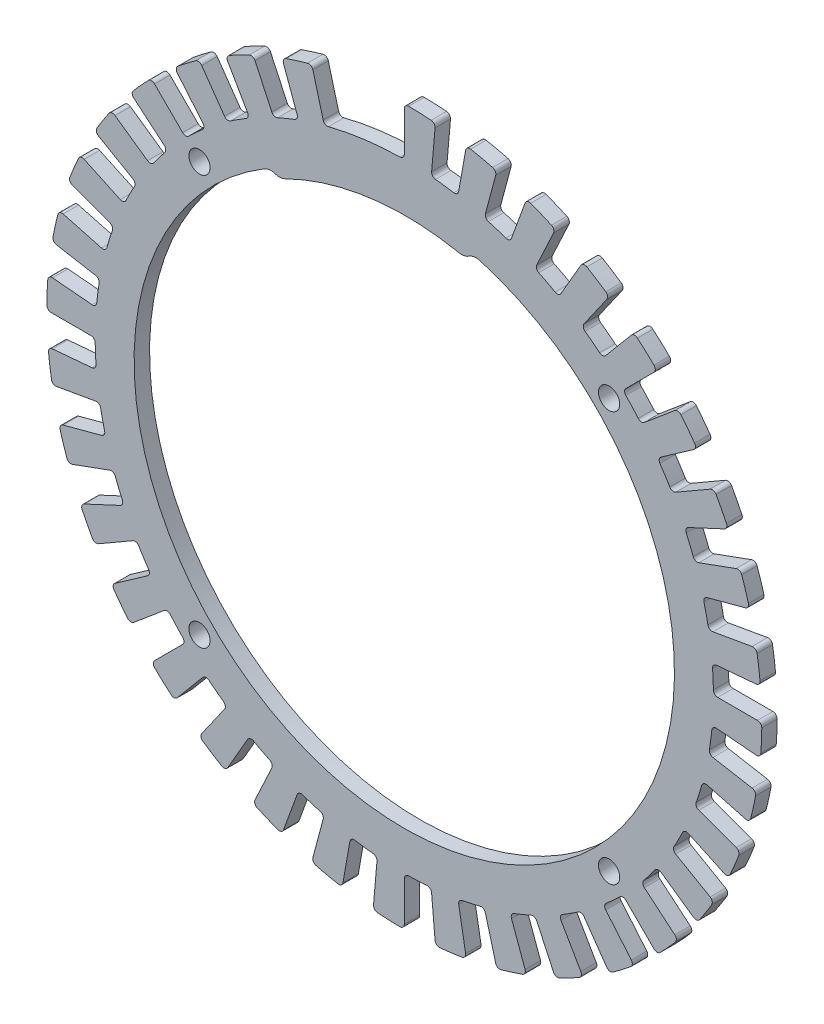
from build123d import *

# Parameters (mm, degrees)
SKETCH1_R           = 2.4585
BOSS_EXTRUDE1_DEPTH = 3.571875


with BuildPart() as part:
    # Sketch1 → Boss-Extrude1 (new body)
    with BuildSketch(Plane.XY):
        with BuildLine():
            Line((7.120090774, 81.383009943), (6.318190247, 72.217244977))
            ThreePointArc((6.318190247, 72.217244977), (6.543925597, 71.492600102), (7.213496876, 71.135191451))
            ThreePointArc((7.213496876, 71.135191451), (9.332622744, 70.888307588), (11.443439394, 70.578308954))
            ThreePointArc((11.443439394, 70.578308954), (12.182699751, 70.750241401), (12.58829525, 71.391769993))
            Line((12.58829525, 71.391769993), (14.185993357, 80.45276622))
            ThreePointArc((14.185993357, 80.45276622), (14.60224868, 81.101765071), (15.35649023, 81.261726586))
            ThreePointArc((15.35649023, 81.261726586), (17.899556073, 80.739679789), (20.424982959, 80.138068801))
            ThreePointArc((20.424982959, 80.138068801), (21.040955292, 79.674338181), (21.143931966, 78.910228368))
            Line((21.143931966, 78.910228368), (18.762595726, 70.022960532))
            ThreePointArc((18.762595726, 70.022960532), (18.859068387, 69.270126109), (19.456404014, 68.801877466))
            ThreePointArc((19.456404014, 68.801877466), (21.500464665, 68.190761978), (23.525382569, 67.518933456))
            ThreePointArc((23.525382569, 67.518933456), (24.283267656, 67.559882649), (24.794101519, 68.12123406))
            Line((24.794101519, 68.12123406), (27.940952485, 76.76713603))
            ThreePointArc((27.940952485, 76.76713603), (28.463581422, 77.333993152), (29.234141374, 77.360551822))
            ThreePointArc((29.234141374, 77.360551822), (31.647919857, 76.404837339), (34.030511182, 75.373830397))
            ThreePointArc((34.030511182, 75.373830397), (34.556599534, 74.810182414), (34.525325484, 74.039799434))
            Line((34.525325484, 74.039799434), (30.636909229, 65.701063864))
            ThreePointArc((30.636909229, 65.701063864), (30.601187928, 64.942914386), (31.108138161, 64.378053249))
            ThreePointArc((31.108138161, 64.378053249), (33.015025846, 63.421274572), (34.892518899, 62.40802933))
            ThreePointArc((34.892518899, 62.40802933), (35.646000762, 62.316751049), (36.24655156, 62.780868901))
            Line((36.24655156, 62.780868901), (40.84693991, 70.748975258))
            ThreePointArc((40.84693991, 70.748975258), (41.460062645, 71.216466984), (42.223527925, 71.108815836))
            ThreePointArc((42.223527925, 71.108815836), (44.43467761, 69.748472569), (46.602039543, 68.319396297))
            ThreePointArc((46.602039543, 68.319396297), (47.022258986, 67.67295711), (46.857684459, 66.91970866))
            Line((46.857684459, 66.91970866), (41.580335748, 59.382873618))
            ThreePointArc((41.580335748, 59.382873618), (41.413505858, 58.642445073), (41.814667271, 57.998134462))
            ThreePointArc((41.814667271, 57.998134462), (43.526442174, 56.724763831), (45.199463699, 55.400888814))
            ThreePointArc((45.199463699, 55.400888814), (45.925648172, 55.180156502), (46.597668473, 55.53293881))
            Line((46.597668473, 55.53293881), (52.511813735, 62.581142673))
            ThreePointArc((52.511813735, 62.581142673), (53.196800845, 62.935064503), (53.929973946, 62.696474464))
            ThreePointArc((53.929973946, 62.696474464), (55.87131017, 60.972835754), (57.757588515, 59.189111912))
            ThreePointArc((57.757588515, 59.189111912), (58.059170893, 58.479523249), (57.766296402, 57.766296402))
            Line((57.766296402, 57.766296402), (51.260364806, 51.260364806))
            ThreePointArc((51.260364806, 51.260364806), (50.967495369, 50.56015474), (51.250678875, 49.855971707))
            ThreePointArc((51.250678875, 49.855971707), (52.715329582, 48.304699845), (54.133045666, 46.710420325))
            ThreePointArc((54.133045666, 46.710420325), (54.809868002, 46.366940822), (55.53293881, 46.597668473))
            Line((55.53293881, 46.597668473), (62.581142673, 52.511813735))
            ThreePointArc((62.581142673, 52.511813735), (63.31718117, 52.741411935), (63.997784998, 52.379132441))
            ThreePointArc((63.997784998, 52.379132441), (65.610321242, 50.344570179), (67.158202386, 48.260396313))
            ThreePointArc((67.158202386, 48.260396313), (67.331984272, 47.509218665), (66.91970866, 46.857684459))
            Line((66.91970866, 46.857684459), (59.382873618, 41.580335748))
            ThreePointArc((59.382873618, 41.580335748), (58.972863325, 40.94161969), (59.129464536, 40.19896048))
            ThreePointArc((59.129464536, 40.19896048), (60.302488376, 38.416921997), (61.421822434, 36.600679351))
            ThreePointArc((61.421822434, 36.600679351), (62.028717727, 36.144889108), (62.780868901, 36.24655156))
            Line((62.780868901, 36.24655156), (70.748975258, 40.84693991))
            ThreePointArc((70.748975258, 40.84693991), (71.513700985, 40.945238253), (72.121055738, 40.470276985))
            ThreePointArc((72.121055738, 40.470276985), (73.355795904, 38.186610315), (74.518248261, 35.865312993))
            ThreePointArc((74.518248261, 35.865312993), (74.55894938, 35.095370514), (74.039799434, 34.525325484))
            Line((74.039799434, 34.525325484), (65.701063864, 30.636909229))
            ThreePointArc((65.701063864, 30.636909229), (65.186370669, 30.079094244), (65.211631338, 29.320524181))
            ThreePointArc((65.211631338, 29.320524181), (66.057386575, 27.361865414), (66.844328207, 25.378845255))
            ThreePointArc((66.844328207, 25.378845255), (67.362856253, 24.824593229), (68.12123406, 24.794101519))
            Line((68.12123406, 24.794101519), (76.76713603, 27.940952485))
            ThreePointArc((76.76713603, 27.940952485), (77.537313183, 27.904964226), (78.052964694, 27.331752641))
            ThreePointArc((78.052964694, 27.331752641), (78.872391827, 24.868369619), (79.614094871, 22.380480286))
            ThreePointArc((79.614094871, 22.380480286), (79.52047854, 21.615167288), (78.910228368, 21.143931966))
            Line((78.910228368, 21.143931966), (70.022960532, 18.762595726))
            ThreePointArc((70.022960532, 18.762595726), (69.419223127, 18.30263074), (69.312375721, 17.551198591))
            ThreePointArc((69.312375721, 17.551198591), (69.805164509, 15.475432397), (70.235802893, 13.385887789))
            ThreePointArc((70.235802893, 13.385887789), (70.650208479, 12.750014647), (71.391769993, 12.58829525))
            Line((71.391769993, 12.58829525), (80.45276622, 14.185993357))
            ThreePointArc((80.45276622, 14.185993357), (81.204993357, 14.016811982), (81.613273815, 13.362766823))
            ThreePointArc((81.613273815, 13.362766823), (81.992490036, 10.794516097), (82.290907495, 8.215628011))
            ThreePointArc((82.290907495, 8.215628011), (82.065818199, 7.478198142), (81.383009943, 7.120090774))
            Line((81.383009943, 7.120090774), (72.217244977, 6.318190247))
            ThreePointArc((72.217244977, 6.318190247), (71.542807618, 5.970051062), (71.30709864, 5.248588713))
            ThreePointArc((71.30709864, 5.248588713), (71.431947843, 3.118786197), (71.49319825, 0.986206897))
            ThreePointArc((71.49319825, 0.986206897), (71.79088987, 0.288033321), (72.49310312, 0))
            Line((72.49310312, 0), (81.69387982, 0))
            ThreePointArc((81.69387982, 0), (82.405300898, -0.297234001), (82.693804909, -1.012239902))
            ThreePointArc((82.693804909, -1.012239902), (82.621287925, -3.607323335), (82.467352536, -6.198851964))
            ThreePointArc((82.467352536, -6.198851964), (82.1176295, -6.88599227), (81.383009943, -7.120090774))
            Line((81.383009943, -7.120090774), (72.217244977, -6.318190247))
            ThreePointArc((72.217244977, -6.318190247), (71.492600102, -6.543925597), (71.135191451, -7.213496876))
            ThreePointArc((71.135191451, -7.213496876), (70.888307588, -9.332622744), (70.578308954, -11.443439394))
            ThreePointArc((70.578308954, -11.443439394), (70.750241401, -12.182699751), (71.391769993, -12.58829525))
            Line((71.391769993, -12.58829525), (80.45276622, -14.185993357))
            ThreePointArc((80.45276622, -14.185993357), (81.101765071, -14.60224868), (81.261726586, -15.35649023))
            ThreePointArc((81.261726586, -15.35649023), (80.739679789, -17.899556073), (80.138068801, -20.424982959))
            ThreePointArc((80.138068801, -20.424982959), (79.674338181, -21.040955292), (78.910228368, -21.143931966))
            Line((78.910228368, -21.143931966), (70.022960532, -18.762595726))
            ThreePointArc((70.022960532, -18.762595726), (69.270126109, -18.859068387), (68.801877466, -19.456404014))
            ThreePointArc((68.801877466, -19.456404014), (68.190761979, -21.500464665), (67.518933456, -23.525382569))
            ThreePointArc((67.518933456, -23.525382569), (67.559882649, -24.283267656), (68.12123406, -24.794101519))
            Line((68.12123406, -24.794101519), (76.76713603, -27.940952485))
            ThreePointArc((76.76713603, -27.940952485), (77.333993152, -28.463581422), (77.360551822, -29.234141374))
            ThreePointArc((77.360551822, -29.234141374), (76.404837339, -31.647919857), (75.373830397, -34.030511182))
            ThreePointArc((75.373830397, -34.030511182), (74.810182414, -34.556599534), (74.039799434, -34.525325484))
            Line((74.039799434, -34.525325484), (65.701063864, -30.636909229))
            ThreePointArc((65.701063864, -30.636909229), (64.942914386, -30.601187928), (64.378053249, -31.10813816))
            ThreePointArc((64.378053249, -31.10813816), (63.421274572, -33.015025846), (62.40802933, -34.892518899))
            ThreePointArc((62.40802933, -34.892518899), (62.316751049, -35.646000762), (62.780868901, -36.24655156))
            Line((62.780868901, -36.24655156), (70.748975258, -40.84693991))
            ThreePointArc((70.748975258, -40.84693991), (71.216466984, -41.460062645), (71.108815836, -42.223527925))
            ThreePointArc((71.108815836, -42.223527925), (69.748472569, -44.43467761), (68.319396297, -46.602039543))
            ThreePointArc((68.319396297, -46.602039543), (67.67295711, -47.022258986), (66.91970866, -46.857684459))
            Line((66.91970866, -46.857684459), (59.382873618, -41.580335748))
            ThreePointArc((59.382873618, -41.580335748), (58.642445073, -41.413505858), (57.998134462, -41.814667271))
            ThreePointArc((57.998134462, -41.814667271), (56.724763831, -43.526442174), (55.400888814, -45.199463699))
            ThreePointArc((55.400888814, -45.199463699), (55.180156502, -45.925648172), (55.53293881, -46.597668473))
            Line((55.53293881, -46.597668473), (62.581142673, -52.511813735))
            ThreePointArc((62.581142673, -52.511813735), (62.935064503, -53.196800845), (62.696474464, -53.929973946))
            ThreePointArc((62.696474464, -53.929973946), (60.972835754, -55.87131017), (59.189111912, -57.757588515))
            ThreePointArc((59.189111912, -57.757588515), (58.479523249, -58.059170893), (57.766296402, -57.766296402))
            Line((57.766296402, -57.766296402), (51.260364806, -51.260364806))
            ThreePointArc((51.260364806, -51.260364806), (50.56015474, -50.967495369), (49.855971707, -51.250678875))
            ThreePointArc((49.855971707, -51.250678875), (48.304699845, -52.715329582), (46.710420325, -54.133045666))
            ThreePointArc((46.710420325, -54.133045666), (46.366940822, -54.809868002), (46.597668473, -55.53293881))
            Line((46.597668473, -55.53293881), (52.511813735, -62.581142673))
            ThreePointArc((52.511813735, -62.581142673), (52.741411935, -63.31718117), (52.379132441, -63.997784998))
            ThreePointArc((52.379132441, -63.997784998), (50.344570179, -65.610321242), (48.260396313, -67.158202386))
            ThreePointArc((48.260396313, -67.158202386), (47.509218665, -67.331984272), (46.857684459, -66.91970866))
            Line((46.857684459, -66.91970866), (41.580335748, -59.382873618))
            ThreePointArc((41.580335748, -59.382873618), (40.94161969, -58.972863325), (40.19896048, -59.129464536))
            ThreePointArc((40.19896048, -59.129464536), (38.416921997, -60.302488376), (36.600679351, -61.421822434))
            ThreePointArc((36.600679351, -61.421822434), (36.144889108, -62.028717727), (36.24655156, -62.780868901))
            Line((36.24655156, -62.780868901), (40.84693991, -70.748975258))
            ThreePointArc((40.84693991, -70.748975258), (40.945238253, -71.513700985), (40.470276985, -72.121055738))
            ThreePointArc((40.470276985, -72.121055738), (38.186610315, -73.355795904), (35.865312993, -74.518248261))
            ThreePointArc((35.865312993, -74.518248261), (35.095370514, -74.55894938), (34.525325484, -74.039799434))
            Line((34.525325484, -74.039799434), (30.636909229, -65.701063864))
            ThreePointArc((30.636909229, -65.701063864), (30.079094244, -65.186370669), (29.320524181, -65.211631338))
            ThreePointArc((29.320524181, -65.211631338), (27.361865414, -66.057386575), (25.378845255, -66.844328207))
            ThreePointArc((25.378845255, -66.844328207), (24.824593229, -67.362856253), (24.794101519, -68.12123406))
            Line((24.794101519, -68.12123406), (27.940952485, -76.76713603))
            ThreePointArc((27.940952485, -76.76713603), (27.904964226, -77.537313183), (27.331752641, -78.052964694))
            ThreePointArc((27.331752641, -78.052964694), (24.868369619, -78.872391827), (22.380480286, -79.614094871))
            ThreePointArc((22.380480286, -79.614094871), (21.615167288, -79.52047854), (21.143931966, -78.910228368))
            Line((21.143931966, -78.910228368), (18.762595726, -70.022960532))
            ThreePointArc((18.762595726, -70.022960532), (18.30263074, -69.419223127), (17.551198591, -69.312375721))
            ThreePointArc((17.551198591, -69.312375721), (15.475432397, -69.805164509), (13.385887789, -70.235802893))
            ThreePointArc((13.385887789, -70.235802893), (12.750014647, -70.650208479), (12.58829525, -71.391769993))
            Line((12.58829525, -71.391769993), (14.185993357, -80.45276622))
            ThreePointArc((14.185993357, -80.45276622), (14.016811982, -81.204993357), (13.362766823, -81.613273815))
            ThreePointArc((13.362766823, -81.613273815), (10.794516097, -81.992490036), (8.215628011, -82.290907495))
            ThreePointArc((8.215628011, -82.290907495), (7.478198142, -82.065818199), (7.120090774, -81.383009943))
            Line((7.120090774, -81.383009943), (6.318190247, -72.217244977))
            ThreePointArc((6.318190247, -72.217244977), (5.970051062, -71.542807618), (5.248588713, -71.30709864))
            ThreePointArc((5.248588713, -71.30709864), (3.118786197, -71.431947843), (0.986206897, -71.49319825))
            ThreePointArc((0.986206897, -71.49319825), (0.288033321, -71.79088987), (0, -72.49310312))
            Line((0, -72.49310312), (0, -81.69387982))
            ThreePointArc((0, -81.69387982), (-0.297234001, -82.405300898), (-1.012239902, -82.693804909))
            ThreePointArc((-1.012239902, -82.693804909), (-3.607323335, -82.621287925), (-6.198851964, -82.467352536))
            ThreePointArc((-6.198851964, -82.467352536), (-6.88599227, -82.1176295), (-7.120090774, -81.383009943))
            Line((-7.120090774, -81.383009943), (-6.318190247, -72.217244977))
            ThreePointArc((-6.318190247, -72.217244977), (-6.543925597, -71.492600102), (-7.213496876, -71.135191451))
            ThreePointArc((-7.213496876, -71.135191451), (-9.332622744, -70.888307588), (-11.443439394, -70.578308954))
            ThreePointArc((-11.443439394, -70.578308954), (-12.182699751, -70.750241401), (-12.58829525, -71.391769993))
            Line((-12.58829525, -71.391769993), (-14.185993357, -80.45276622))
            ThreePointArc((-14.185993357, -80.45276622), (-14.60224868, -81.101765071), (-15.35649023, -81.261726586))
            ThreePointArc((-15.35649023, -81.261726586), (-17.899556073, -80.739679789), (-20.424982959, -80.138068801))
            ThreePointArc((-20.424982959, -80.138068801), (-21.040955292, -79.674338181), (-21.143931966, -78.910228368))
            Line((-21.143931966, -78.910228368), (-18.762595726, -70.022960532))
            ThreePointArc((-18.762595726, -70.022960532), (-18.859068387, -69.270126109), (-19.456404014, -68.801877466))
            ThreePointArc((-19.456404014, -68.801877466), (-21.500464665, -68.190761979), (-23.525382569, -67.518933456))
            ThreePointArc((-23.525382569, -67.518933456), (-24.283267656, -67.559882649), (-24.794101519, -68.12123406))
            Line((-24.794101519, -68.12123406), (-27.940952485, -76.76713603))
            ThreePointArc((-27.940952485, -76.76713603), (-28.463581422, -77.333993152), (-29.234141374, -77.360551822))
            ThreePointArc((-29.234141374, -77.360551822), (-31.647919857, -76.404837339), (-34.030511182, -75.373830397))
            ThreePointArc((-34.030511182, -75.373830397), (-34.556599534, -74.810182414), (-34.525325484, -74.039799434))
            Line((-34.525325484, -74.039799434), (-30.636909229, -65.701063864))
            ThreePointArc((-30.636909229, -65.701063864), (-30.601187928, -64.942914386), (-31.10813816, -64.378053249))
            ThreePointArc((-31.10813816, -64.378053249), (-33.015025846, -63.421274572), (-34.892518899, -62.40802933))
            ThreePointArc((-34.892518899, -62.40802933), (-35.646000762, -62.316751049), (-36.24655156, -62.780868901))
            Line((-36.24655156, -62.780868901), (-40.84693991, -70.748975258))
            ThreePointArc((-40.84693991, -70.748975258), (-41.460062645, -71.216466984), (-42.223527925, -71.108815836))
            ThreePointArc((-42.223527925, -71.108815836), (-44.43467761, -69.748472569), (-46.602039543, -68.319396297))
            ThreePointArc((-46.602039543, -68.319396297), (-47.022258986, -67.67295711), (-46.857684459, -66.91970866))
            Line((-46.857684459, -66.91970866), (-41.580335748, -59.382873618))
            ThreePointArc((-41.580335748, -59.382873618), (-41.413505858, -58.642445073), (-41.814667271, -57.998134462))
            ThreePointArc((-41.814667271, -57.998134462), (-43.526442174, -56.724763831), (-45.199463699, -55.400888814))
            ThreePointArc((-45.199463699, -55.400888814), (-45.925648172, -55.180156502), (-46.597668473, -55.53293881))
            Line((-46.597668473, -55.53293881), (-52.511813735, -62.581142673))
            ThreePointArc((-52.511813735, -62.581142673), (-53.196800845, -62.935064504), (-53.929973946, -62.696474464))
            ThreePointArc((-53.929973946, -62.696474464), (-55.87131017, -60.972835754), (-57.757588515, -59.189111912))
            ThreePointArc((-57.757588515, -59.189111912), (-58.059170893, -58.479523249), (-57.766296402, -57.766296402))
            Line((-57.766296402, -57.766296402), (-51.260364806, -51.260364806))
            ThreePointArc((-51.260364806, -51.260364806), (-50.967495369, -50.56015474), (-51.250678875, -49.855971707))
            ThreePointArc((-51.250678875, -49.855971707), (-52.715329582, -48.304699845), (-54.133045666, -46.710420325))
            ThreePointArc((-54.133045666, -46.710420325), (-54.809868002, -46.366940822), (-55.53293881, -46.597668473))
            Line((-55.53293881, -46.597668473), (-62.581142673, -52.511813735))
            ThreePointArc((-62.581142673, -52.511813735), (-63.31718117, -52.741411935), (-63.997784998, -52.379132441))
            ThreePointArc((-63.997784998, -52.379132441), (-65.610321242, -50.344570179), (-67.158202386, -48.260396313))
            ThreePointArc((-67.158202386, -48.260396313), (-67.331984272, -47.509218665), (-66.91970866, -46.857684459))
            Line((-66.91970866, -46.857684459), (-59.382873618, -41.580335748))
            ThreePointArc((-59.382873618, -41.580335748), (-58.972863325, -40.94161969), (-59.129464536, -40.19896048))
            ThreePointArc((-59.129464536, -40.19896048), (-60.302488376, -38.416921997), (-61.421822434, -36.600679351))
            ThreePointArc((-61.421822434, -36.600679351), (-62.028717727, -36.144889108), (-62.780868901, -36.24655156))
            Line((-62.780868901, -36.24655156), (-70.748975258, -40.84693991))
            ThreePointArc((-70.748975258, -40.84693991), (-71.513700985, -40.945238253), (-72.121055738, -40.470276985))
            ThreePointArc((-72.121055738, -40.470276985), (-73.355795904, -38.186610315), (-74.518248261, -35.865312993))
            ThreePointArc((-74.518248261, -35.865312993), (-74.55894938, -35.095370514), (-74.039799434, -34.525325484))
            Line((-74.039799434, -34.525325484), (-65.701063864, -30.636909229))
            ThreePointArc((-65.701063864, -30.636909229), (-65.186370669, -30.079094244), (-65.211631338, -29.320524181))
            ThreePointArc((-65.211631338, -29.320524181), (-66.057386575, -27.361865414), (-66.844328207, -25.378845255))
            ThreePointArc((-66.844328207, -25.378845255), (-67.362856253, -24.824593229), (-68.12123406, -24.794101519))
            Line((-68.12123406, -24.794101519), (-76.76713603, -27.940952485))
            ThreePointArc((-76.76713603, -27.940952485), (-77.537313183, -27.904964226), (-78.052964694, -27.331752641))
            ThreePointArc((-78.052964694, -27.331752641), (-78.872391827, -24.868369619), (-79.614094871, -22.380480286))
            ThreePointArc((-79.614094871, -22.380480286), (-79.52047854, -21.615167288), (-78.910228368, -21.143931966))
            Line((-78.910228368, -21.143931966), (-70.022960532, -18.762595726))
            ThreePointArc((-70.022960532, -18.762595726), (-69.419223127, -18.30263074), (-69.312375721, -17.551198591))
            ThreePointArc((-69.312375721, -17.551198591), (-69.805164509, -15.475432397), (-70.235802893, -13.385887789))
            ThreePointArc((-70.235802893, -13.385887789), (-70.650208479, -12.750014647), (-71.391769993, -12.58829525))
            Line((-71.391769993, -12.58829525), (-80.45276622, -14.185993357))
            ThreePointArc((-80.45276622, -14.185993357), (-81.204993357, -14.016811982), (-81.613273815, -13.362766823))
            ThreePointArc((-81.613273815, -13.362766823), (-81.992490036, -10.794516097), (-82.290907495, -8.215628011))
            ThreePointArc((-82.290907495, -8.215628011), (-82.065818199, -7.478198142), (-81.383009943, -7.120090774))
            Line((-81.383009943, -7.120090774), (-72.217244977, -6.318190247))
            ThreePointArc((-72.217244977, -6.318190247), (-71.542807618, -5.970051062), (-71.30709864, -5.248588713))
            ThreePointArc((-71.30709864, -5.248588713), (-71.431947843, -3.118786197), (-71.49319825, -0.986206897))
            ThreePointArc((-71.49319825, -0.986206897), (-71.79088987, -0.288033321), (-72.49310312, 0))
            Line((-72.49310312, 0), (-81.69387982, 0))
            ThreePointArc((-81.69387982, 0), (-82.405300898, 0.297234001), (-82.693804909, 1.012239902))
            ThreePointArc((-82.693804909, 1.012239902), (-82.621287925, 3.607323335), (-82.467352536, 6.198851964))
            ThreePointArc((-82.467352536, 6.198851964), (-82.1176295, 6.88599227), (-81.383009943, 7.120090774))
            Line((-81.383009943, 7.120090774), (-72.217244977, 6.318190247))
            ThreePointArc((-72.217244977, 6.318190247), (-71.492600102, 6.543925597), (-71.135191451, 7.213496876))
            ThreePointArc((-71.135191451, 7.213496876), (-70.888307588, 9.332622744), (-70.578308954, 11.443439394))
            ThreePointArc((-70.578308954, 11.443439394), (-70.750241401, 12.182699751), (-71.391769993, 12.58829525))
            Line((-71.391769993, 12.58829525), (-80.45276622, 14.185993357))
            ThreePointArc((-80.45276622, 14.185993357), (-81.101765071, 14.60224868), (-81.261726586, 15.35649023))
            ThreePointArc((-81.261726586, 15.35649023), (-80.739679789, 17.899556073), (-80.138068801, 20.424982959))
            ThreePointArc((-80.138068801, 20.424982959), (-79.674338181, 21.040955292), (-78.910228368, 21.143931966))
            Line((-78.910228368, 21.143931966), (-70.022960532, 18.762595726))
            ThreePointArc((-70.022960532, 18.762595726), (-69.270126109, 18.859068387), (-68.801877466, 19.456404014))
            ThreePointArc((-68.801877466, 19.456404014), (-68.190761979, 21.500464665), (-67.518933456, 23.525382569))
            ThreePointArc((-67.518933456, 23.525382569), (-67.559882649, 24.283267656), (-68.12123406, 24.794101519))
            Line((-68.12123406, 24.794101519), (-76.76713603, 27.940952485))
            ThreePointArc((-76.76713603, 27.940952485), (-77.333993152, 28.463581422), (-77.360551822, 29.234141374))
            ThreePointArc((-77.360551822, 29.234141374), (-76.404837339, 31.647919857), (-75.373830397, 34.030511182))
            ThreePointArc((-75.373830397, 34.030511182), (-74.810182414, 34.556599534), (-74.039799434, 34.525325484))
            Line((-74.039799434, 34.525325484), (-65.701063864, 30.636909229))
            ThreePointArc((-65.701063864, 30.636909229), (-64.942914386, 30.601187928), (-64.378053249, 31.10813816))
            ThreePointArc((-64.378053249, 31.10813816), (-63.421274572, 33.015025846), (-62.40802933, 34.892518899))
            ThreePointArc((-62.40802933, 34.892518899), (-62.316751049, 35.646000762), (-62.780868901, 36.24655156))
            Line((-62.780868901, 36.24655156), (-70.748975258, 40.84693991))
            ThreePointArc((-70.748975258, 40.84693991), (-71.216466984, 41.460062645), (-71.108815836, 42.223527925))
            ThreePointArc((-71.108815836, 42.223527925), (-69.748472569, 44.43467761), (-68.319396297, 46.602039543))
            ThreePointArc((-68.319396297, 46.602039543), (-67.67295711, 47.022258986), (-66.91970866, 46.857684459))
            Line((-66.91970866, 46.857684459), (-59.382873618, 41.580335748))
            ThreePointArc((-59.382873618, 41.580335748), (-58.642445073, 41.413505858), (-57.998134462, 41.814667271))
            ThreePointArc((-57.998134462, 41.814667271), (-56.724763831, 43.526442174), (-55.400888814, 45.199463699))
            ThreePointArc((-55.400888814, 45.199463699), (-55.180156502, 45.925648172), (-55.53293881, 46.597668473))
            Line((-55.53293881, 46.597668473), (-62.581142673, 52.511813735))
            ThreePointArc((-62.581142673, 52.511813735), (-62.935064504, 53.196800845), (-62.696474464, 53.929973946))
            ThreePointArc((-62.696474464, 53.929973946), (-60.972835754, 55.87131017), (-59.189111912, 57.757588515))
            ThreePointArc((-59.189111912, 57.757588515), (-58.479523249, 58.059170893), (-57.766296402, 57.766296402))
            Line((-57.766296402, 57.766296402), (-51.260364806, 51.260364806))
            ThreePointArc((-51.260364806, 51.260364806), (-50.56015474, 50.967495369), (-49.855971707, 51.250678875))
            ThreePointArc((-49.855971707, 51.250678875), (-48.304699845, 52.715329582), (-46.710420325, 54.133045666))
            ThreePointArc((-46.710420325, 54.133045666), (-46.366940822, 54.809868002), (-46.597668473, 55.53293881))
            Line((-46.597668473, 55.53293881), (-52.511813735, 62.581142673))
            ThreePointArc((-52.511813735, 62.581142673), (-52.741411935, 63.31718117), (-52.379132441, 63.997784998))
            ThreePointArc((-52.379132441, 63.997784998), (-50.344570179, 65.610321242), (-48.260396313, 67.158202386))
            ThreePointArc((-48.260396313, 67.158202386), (-47.509218665, 67.331984272), (-46.857684459, 66.91970866))
            Line((-46.857684459, 66.91970866), (-41.580335748, 59.382873618))
            ThreePointArc((-41.580335748, 59.382873618), (-40.94161969, 58.972863325), (-40.19896048, 59.129464536))
            ThreePointArc((-40.19896048, 59.129464536), (-38.416921997, 60.302488376), (-36.600679351, 61.421822434))
            ThreePointArc((-36.600679351, 61.421822434), (-36.144889108, 62.028717727), (-36.24655156, 62.780868901))
            Line((-36.24655156, 62.780868901), (-40.84693991, 70.748975258))
            ThreePointArc((-40.84693991, 70.748975258), (-40.945238253, 71.513700985), (-40.470276985, 72.121055738))
            ThreePointArc((-40.470276985, 72.121055738), (-38.186610315, 73.355795904), (-35.865312993, 74.518248261))
            ThreePointArc((-35.865312993, 74.518248261), (-35.095370514, 74.55894938), (-34.525325484, 74.039799434))
            Line((-34.525325484, 74.039799434), (-30.636909229, 65.701063864))
            ThreePointArc((-30.636909229, 65.701063864), (-30.079094244, 65.186370669), (-29.320524181, 65.211631338))
            ThreePointArc((-29.320524181, 65.211631338), (-27.361865414, 66.057386575), (-25.378845255, 66.844328207))
            ThreePointArc((-25.378845255, 66.844328207), (-24.824593229, 67.362856253), (-24.794101519, 68.12123406))
            Line((-24.794101519, 68.12123406), (-27.940952485, 76.76713603))
            ThreePointArc((-27.940952485, 76.76713603), (-27.904964226, 77.537313183), (-27.331752641, 78.052964694))
            ThreePointArc((-27.331752641, 78.052964694), (-24.868369619, 78.872391827), (-22.380480286, 79.614094871))
            ThreePointArc((-22.380480286, 79.614094871), (-21.615167288, 79.52047854), (-21.143931966, 78.910228368))
            Line((-21.143931966, 78.910228368), (-18.762595726, 70.022960532))
            ThreePointArc((-18.762595726, 70.022960532), (-18.30263074, 69.419223127), (-17.551198591, 69.312375721))
            ThreePointArc((-17.551198591, 69.312375721), (-15.475432397, 69.805164509), (-13.385887789, 70.235802893))
            ThreePointArc((-13.385887789, 70.235802893), (-7.213573177, 71.135183714), (-0.986360266, 71.493196134))
            ThreePointArc((-0.986360266, 71.493196134), (-0.288033321, 71.79088987), (0, 72.49310312))
            Line((0, 72.49310312), (0, 81.69387982))
            ThreePointArc((0, 81.69387982), (0.297234001, 82.405300898), (1.012239902, 82.693804909))
            ThreePointArc((1.012239902, 82.693804909), (3.607323335, 82.621287925), (6.198851964, 82.467352536))
            ThreePointArc((6.198851964, 82.467352536), (6.88599227, 82.1176295), (7.120090774, 81.383009943))
        make_face()
        with Locations((47.376154339, 47.376154339)):
            Circle(SKETCH1_R, mode=Mode.SUBTRACT)
        with Locations((-47.376154339, -47.376154339)):
            Circle(SKETCH1_R, mode=Mode.SUBTRACT)
        with Locations((47.376154339, -47.376154339)):
            Circle(SKETCH1_R, mode=Mode.SUBTRACT)
        with Locations((-47.376154339, 47.376154339)):
            Circle(SKETCH1_R, mode=Mode.SUBTRACT)
        with BuildLine():
            ThreePointArc((-32.399534916, 53.446423053), (8.157887014, -61.965303836), (17.462595357, 60.010897039))
            ThreePointArc((17.462595357, 60.010897039), (16.158723626, 60.09401264), (14.943172899, 59.61502817))
            ThreePointArc((14.943172899, 59.61502817), (13.835125402, 59.154945408), (12.635405963, 59.165839098))
            ThreePointArc((12.635405963, 59.165839098), (-7.879614623, 59.851615177), (-27.518110923, 53.879528313))
            ThreePointArc((-27.518110923, 53.879528313), (-28.674131419, 53.558495577), (-29.863501295, 53.716117604))
            ThreePointArc((-29.863501295, 53.716117604), (-31.161603438, 53.864173396), (-32.399534916, 53.446423053))
        make_face(mode=Mode.SUBTRACT)
    extrude(amount=BOSS_EXTRUDE1_DEPTH)


solid = part.part
